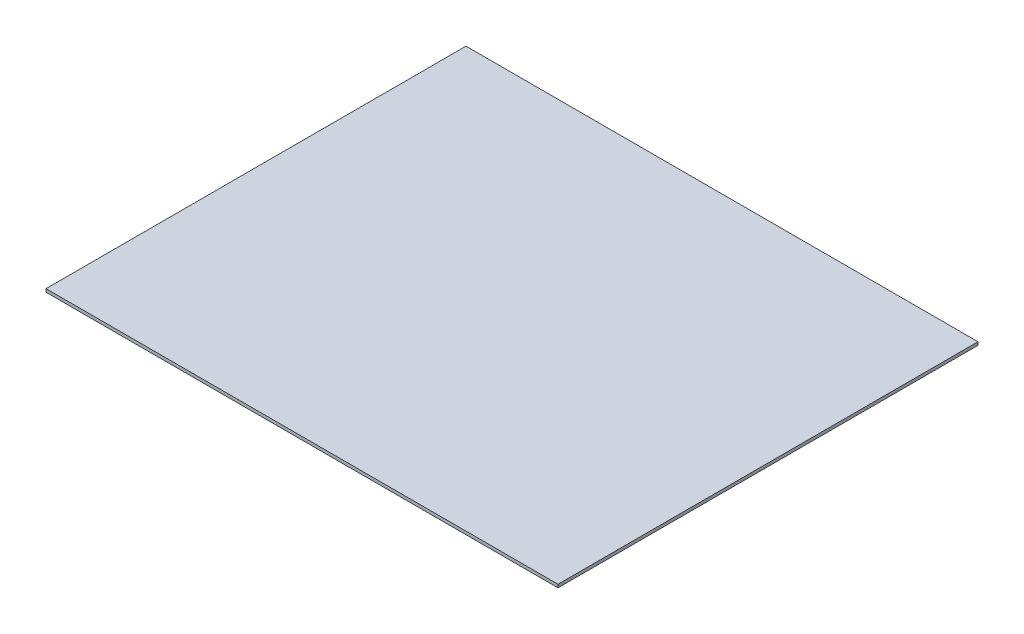
from build123d import *

# Parameters (mm, degrees)
SKETCH1_W           = 374.65
SKETCH1_H           = 307.34
BOSS_EXTRUDE1_DEPTH = 2.286


with BuildPart() as part:
    # Sketch1 → Boss-Extrude1 (new body)
    with BuildSketch(Plane(origin=(0, 0, 0), x_dir=(1, 0, 0), z_dir=(0, 1, 0))):
        Rectangle(SKETCH1_W, SKETCH1_H)
    extrude(amount=BOSS_EXTRUDE1_DEPTH)


solid = part.part
